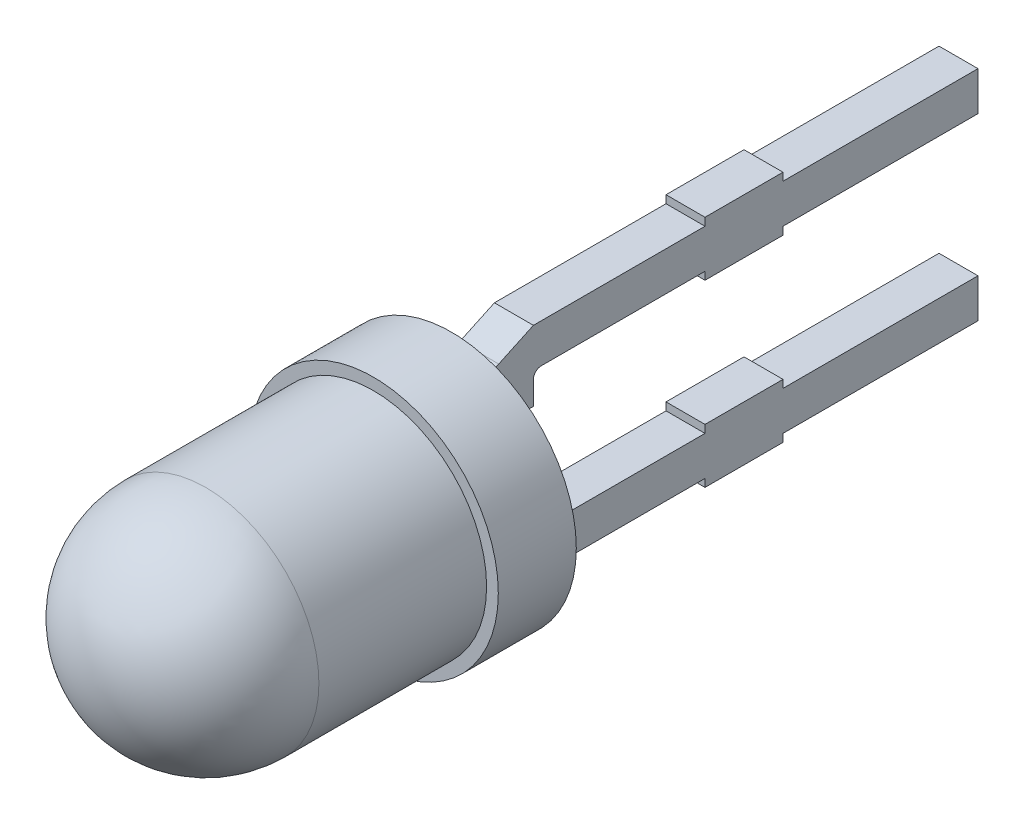
from build123d import *

# Parameters (mm, degrees)
EXTRUDE1_DEPTH          = 0.25
FILLET1_R               = 0.25
CUT_EXTRUDE1_DEPTH      = 31.234789562
CUT_EXTRUDE1_DEPTH_BACK = 31.234789562
SKETCH3_W               = 12
SKETCH3_H               = 2.8
CUT_EXTRUDE2_DEPTH      = 19.290502996
CUT_EXTRUDE2_DEPTH_BACK = 19.290502996
SKETCH4_W               = 10.458218954
SKETCH4_H               = 4.610430397


with BuildPart() as part:
    # Sketch1 → Revolve1 (revolve)
    with BuildSketch(Plane(origin=(0, 0, 0), x_dir=(0, 0, -1), z_dir=(1, 0, 0))):
        with BuildLine():
            Line((0, 1.45), (2.15, 1.45))
            Line((2.15, 1.45), (2.15, 1.599999975))
            Line((2.15, 1.599999975), (3.15, 1.599999975))
            Line((3.15, 1.599999975), (3.15, 0))
            Line((3.15, 0), (-1.45, 0))
            ThreePointArc((-1.45, 0), (-1.025304833, 1.025304833), (0, 1.45))
        make_face()
    revolve(axis=Axis((0, 0, 0), (0, 0, -1)))

    # Sketch2 → Extrude1 (add, symmetric)
    with BuildSketch(Plane(origin=(0, 0, 0), x_dir=(0, 0, -1), z_dir=(1, 0, 0))):
        with BuildLine():
            Line((3.15, 1.026953873), (3.95, 1.4))
            Line((3.95, 1.4), (6.15, 1.4))
            Line((6.15, 1.4), (6.15, 1.5))
            Line((6.15, 1.5), (7.15, 1.5))
            Line((7.15, 1.5), (7.15, 1.4))
            Line((7.15, 1.4), (30.15, 1.4))
            Line((30.15, 1.4), (30.15, 0.9))
            Line((30.15, 0.9), (7.15, 0.9))
            Line((7.15, 0.9), (7.15, 0.8))
            Line((7.15, 0.8), (6.15, 0.8))
            Line((6.15, 0.8), (6.15, 0.9))
            Line((6.15, 0.9), (4.05, 0.9))
            ThreePointArc((4.05, 0.9), (3.979289322, 0.870710678), (3.95, 0.8))
            Line((3.95, 0.8), (3.95, 0.5))
            Line((3.95, 0.5), (3.15, 0.5))
            Line((3.15, 0.5), (3.15, 1.026953873))
        make_face()
        with BuildLine():
            Line((3.95, -0.8), (3.95, -0.5))
            Line((3.95, -0.5), (3.15, -0.5))
            Line((3.15, -0.5), (3.15, -1.026953873))
            Line((3.15, -1.026953873), (3.95, -1.4))
            Line((3.95, -1.4), (6.15, -1.4))
            Line((6.15, -1.4), (6.15, -1.5))
            Line((6.15, -1.5), (7.15, -1.5))
            Line((7.15, -1.5), (7.15, -1.4))
            Line((7.15, -1.4), (30.15, -1.4))
            Line((30.15, -1.4), (30.15, -0.9))
            Line((30.15, -0.9), (7.15, -0.9))
            Line((7.15, -0.9), (7.15, -0.8))
            Line((7.15, -0.8), (6.15, -0.8))
            Line((6.15, -0.8), (6.15, -0.9))
            Line((6.15, -0.9), (4.05, -0.9))
            ThreePointArc((4.05, -0.9), (3.979289322, -0.870710678), (3.95, -0.8))
        make_face()
    extrude(amount=EXTRUDE1_DEPTH, both=True)

    # Fillet1
    fillet1_edges = [part.edges().sort_by_distance(p)[0] for p in [
        (0, -0.5, -3.15),
        (0, -1.026953873, -3.15),
        (-0.25, -0.763476937, -3.15),
        (0, 0.5, -3.15),
        (-0.25, 0.763476937, -3.15),
        (0, 1.026953873, -3.15),
        (0.25, 0.763476937, -3.15),
        (0.25, -0.763476937, -3.15),
    ]]
    fillet(fillet1_edges, radius=FILLET1_R)

    # Sketch3 → Cut-Extrude1 (cut, two sides: drawn at the far end of the back side and taken through both)
    with BuildSketch(Plane(origin=(0, 0, 0), x_dir=(0, 0, -1), z_dir=(1, 0, 0)).offset(-CUT_EXTRUDE1_DEPTH_BACK)):
        with Locations((24.15, 0)):
            Rectangle(SKETCH3_W, SKETCH3_H)
    extrude(amount=CUT_EXTRUDE1_DEPTH + CUT_EXTRUDE1_DEPTH_BACK, mode=Mode.SUBTRACT)

    # Sketch4 → Cut-Extrude2 (cut, two sides: drawn at the far end of the back side and taken through both)
    with BuildSketch(Plane(origin=(0, 0, 0), x_dir=(0, 0, -1), z_dir=(1, 0, 0)).offset(-CUT_EXTRUDE2_DEPTH_BACK)):
        with Locations((14.879109477, 0.110175727)):
            Rectangle(SKETCH4_W, SKETCH4_H)
    extrude(amount=CUT_EXTRUDE2_DEPTH + CUT_EXTRUDE2_DEPTH_BACK, mode=Mode.SUBTRACT)


solid = part.part
